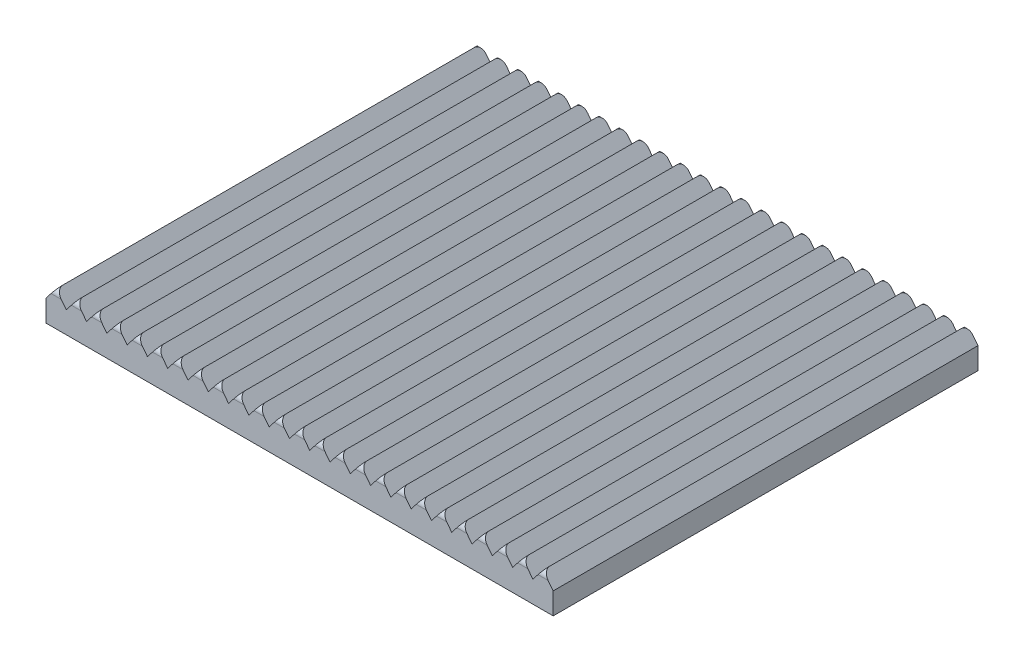
from build123d import *

# Parameters (mm, degrees)
SKETCH1_W           = 58.5
SKETCH1_H           = 49
SKETCH1_R           = 3.1
BOSS_EXTRUDE1_DEPTH = 1.5
BOSS_EXTRUDE2_DEPTH = 49
CUT_EXTRUDE1_DEPTH  = 1
CHAMFER2_SIZE       = 0.2
CUT_EXTRUDE3_DEPTH  = 64.549193543
BOSS_EXTRUDE3_START = 0.5
SKETCH5_R           = 3.1
BOSS_EXTRUDE3_DEPTH = 0.5
SKETCH6_W           = 3.5
SKETCH6_H           = 2.441191684
CUT_EXTRUDE4_DEPTH  = 0.5
CHAMFER3_SIZE       = 1.5


with BuildPart() as part:
    # Sketch1 → Boss-Extrude1 (new body)
    with BuildSketch(Plane(origin=(0, 0, 0), x_dir=(1, 0, 0), z_dir=(0, 1, 0))):
        Rectangle(SKETCH1_W, SKETCH1_H)
        with Locations(Location((0, 0, 0), (0, 0, 270))):
            Circle(SKETCH1_R, mode=Mode.SUBTRACT)
    extrude(amount=BOSS_EXTRUDE1_DEPTH)

    # Sketch2 → Boss-Extrude2 (add)
    with BuildSketch(Plane(origin=(0, 0, -24.5), x_dir=(-1, 0, 0), z_dir=(0, 0, -1))):
        Polygon((-29.25, 1.5), (29.25, 1.5), (29.25, 2.5), (28.08, 4), (26.91, 2.5), (25.74, 4), (24.57, 2.5), (23.4, 4), (22.23, 2.5), (21.06, 4), (19.89, 2.5), (18.72, 4), (17.55, 2.5), (16.38, 4), (15.21, 2.5), (14.04, 4), (12.87, 2.5), (11.7, 4), (10.53, 2.5), (9.36, 4), (8.19, 2.5), (7.02, 4), (5.85, 2.5), (4.68, 4), (3.51, 2.5), (2.34, 4), (1.17, 2.5), (0, 4), (-1.17, 2.5), (-2.34, 4), (-3.51, 2.5), (-4.68, 4), (-5.85, 2.5), (-7.02, 4), (-8.19, 2.5), (-9.36, 4), (-10.53, 2.5), (-11.7, 4), (-12.87, 2.5), (-14.04, 4), (-15.21, 2.5), (-16.38, 4), (-17.55, 2.5), (-18.72, 4), (-19.89, 2.5), (-21.06, 4), (-22.23, 2.5), (-23.4, 4), (-24.57, 2.5), (-25.74, 4), (-26.91, 2.5), (-28.08, 4), (-29.25, 2.5), align=None)
    extrude(amount=-BOSS_EXTRUDE2_DEPTH)

    # Sketch3 → Cut-Extrude1 (cut)
    with BuildSketch(Plane(origin=(0, 0, 0), x_dir=(-1, 0, 0), z_dir=(0, -1, 0))):
        with BuildLine():
            Line((-1.75, -2.558808316), (-1.75, -5))
            Line((-1.75, -5), (1.75, -5))
            Line((1.75, -5), (1.75, -2.558808316))
            ThreePointArc((1.75, -2.558808316), (0, 3.1), (-1.75, -2.558808316))
        make_face()
    extrude(amount=-CUT_EXTRUDE1_DEPTH, mode=Mode.SUBTRACT)

    # Chamfer2
    chamfer2_edges = [part.edges().sort_by_distance(p)[0] for p in [
        (0, 0, -3.1),
    ]]
    chamfer(chamfer2_edges, length=CHAMFER2_SIZE)

    # Sketch4 → Cut-Extrude3 (cut, through all)
    with BuildSketch(Plane(origin=(29.25, 0, 0), x_dir=(0, 0, -1), z_dir=(1, 0, 0))):
        with BuildLine():
            Line((-23.75, 4), (-24.5, 4))
            Line((-24.5, 4), (-24.5, 3.25))
            ThreePointArc((-24.5, 3.25), (-24.280330086, 3.780330086), (-23.75, 4))
        make_face()
    cut_extrude3 = extrude(amount=-CUT_EXTRUDE3_DEPTH, mode=Mode.SUBTRACT)

    # Mirror1: Cut-Extrude3 across plane
    add(cut_extrude3.mirror(Plane.XY), mode=Mode.SUBTRACT)

    # Sketch5 → Boss-Extrude3 (add)
    with BuildSketch(Plane.XZ.offset(-1.5).offset(BOSS_EXTRUDE3_START)):
        Circle(SKETCH5_R)
    extrude(amount=-BOSS_EXTRUDE3_DEPTH)

    # Sketch6 → Cut-Extrude4 (cut)
    with BuildSketch(Plane.XZ.offset(-1)):
        with Locations((0, 3.779404158)):
            Rectangle(SKETCH6_W, SKETCH6_H)
    extrude(amount=-CUT_EXTRUDE4_DEPTH, mode=Mode.SUBTRACT)

    # Chamfer3
    chamfer3_edges = [part.edges().sort_by_distance(p)[0] for p in [
        (0, 0, 5),
    ]]
    chamfer(chamfer3_edges, length=CHAMFER3_SIZE - 0.0001)  # a hair under: the kernel refuses the full size


solid = part.part
